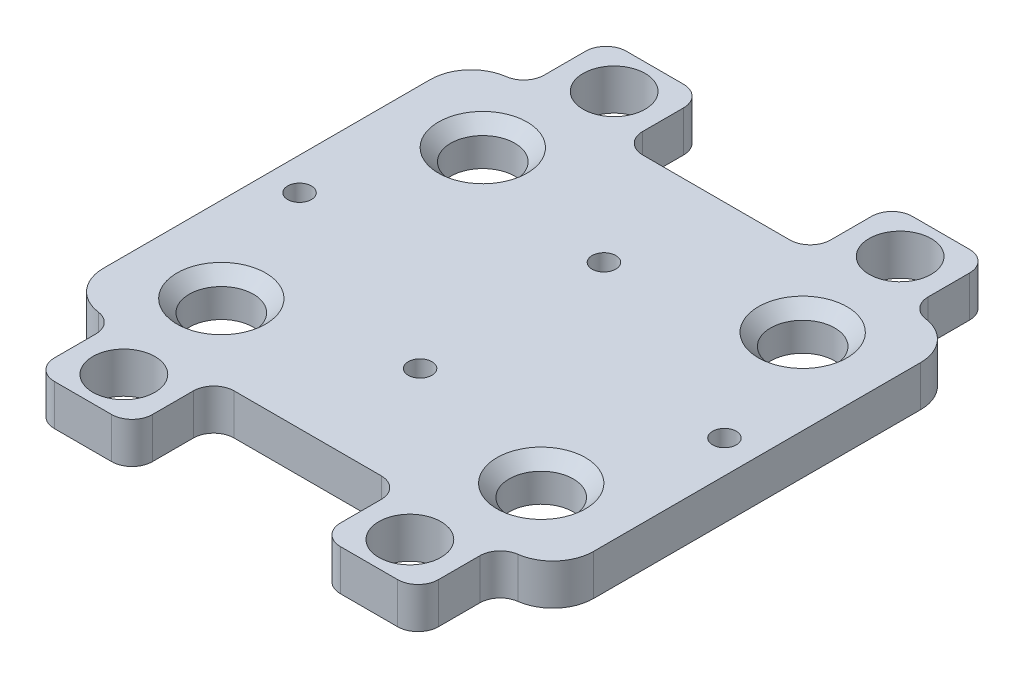
from build123d import *

# Parameters (mm, degrees)
SKETCH1_W           = 50
SKETCH1_H           = 5
BOSS_EXTRUDE1_DEPTH = 60
SKETCH2_R           = 3.925
SKETCH2_R_2         = 1.45
CUT_EXTRUDE1_DEPTH  = 79.262379212
CHAMFER1_SIZE       = 1.5
FILLET2_R           = 5
SKETCH2_3_W         = 12
SKETCH2_3_H         = 10
SKETCH2_3_R         = 3.8
BOSS_EXTRUDE2_DEPTH = 5
FILLET5_R           = 2.5
FILLET6_R           = 2.5
CHAMFER2_SIZE       = 1.5
CHAMFER3_SIZE       = 1.5


with BuildPart() as part:
    # Sketch1 → Boss-Extrude1 (new body)
    with BuildSketch(Plane(origin=(0, 0, 0), x_dir=(0, 0, -1), z_dir=(1, 0, 0))):
        with Locations((25, 2.5)):
            Rectangle(SKETCH1_W, SKETCH1_H)
    extrude(amount=BOSS_EXTRUDE1_DEPTH)

    # Sketch2 → Cut-Extrude1 (cut, through all)
    with BuildSketch(Plane(origin=(0, 5, 0), x_dir=(1, 0, 0), z_dir=(0, 1, 0))):
        with Locations((49.575, 41)):
            Circle(SKETCH2_R)
        with Locations((10.425, 41)):
            Circle(SKETCH2_R)
        with Locations((10.425, 9)):
            Circle(SKETCH2_R)
        with Locations((49.575, 9)):
            Circle(SKETCH2_R)
        with Locations((30, 36.25)):
            Circle(SKETCH2_R_2)
        with Locations((30, 13.75)):
            Circle(SKETCH2_R_2)
        with Locations((56, 25)):
            Circle(SKETCH2_R_2)
        with Locations((4, 25)):
            Circle(SKETCH2_R_2)
    extrude(amount=-CUT_EXTRUDE1_DEPTH, mode=Mode.SUBTRACT)

    # Chamfer1
    chamfer1_edges = [part.edges().sort_by_distance(p)[0] for p in [
        (6.5, 5, -9),
        (45.65, 5, -9),
        (6.5, 5, -41),
        (45.65, 5, -41),
    ]]
    chamfer(chamfer1_edges, length=CHAMFER1_SIZE)

    # Fillet2
    fillet2_edges = [part.edges().sort_by_distance(p)[0] for p in [
        (0, 2.5, -50),
        (0, 2.5, 0),
        (60, 2.5, 0),
        (60, 2.5, -50),
    ]]
    fillet(fillet2_edges, radius=FILLET2_R)

    # Sketch2<3> → Boss-Extrude2 (add)
    # profile 1 of 4: a face of its own
    with BuildSketch(Plane(origin=(0, 5, 0), x_dir=(1, 0, 0), z_dir=(0, 1, 0))):
        with Locations((47.5, 55)):
            Rectangle(SKETCH2_3_W, SKETCH2_3_H)
        with Locations((47.5, 55)):
            Circle(SKETCH2_3_R, mode=Mode.SUBTRACT)
    # profile 2 of 4: a face of its own
    with BuildSketch(Plane(origin=(0, 5, 0), x_dir=(1, 0, 0), z_dir=(0, 1, 0))):
        with Locations((12.5, 55)):
            Rectangle(SKETCH2_3_W, SKETCH2_3_H)
        with Locations((12.5, 55)):
            Circle(SKETCH2_3_R, mode=Mode.SUBTRACT)
    # profile 3 of 4: a face of its own
    with BuildSketch(Plane(origin=(0, 5, 0), x_dir=(1, 0, 0), z_dir=(0, 1, 0))):
        with Locations((47.5, -5)):
            Rectangle(SKETCH2_3_W, SKETCH2_3_H)
        with Locations((47.5, -5)):
            Circle(SKETCH2_3_R, mode=Mode.SUBTRACT)
    # profile 4 of 4: a face of its own
    with BuildSketch(Plane(origin=(0, 5, 0), x_dir=(1, 0, 0), z_dir=(0, 1, 0))):
        with Locations((12.5, -5)):
            Rectangle(SKETCH2_3_W, SKETCH2_3_H)
        with Locations((12.5, -5)):
            Circle(SKETCH2_3_R, mode=Mode.SUBTRACT)
    extrude(amount=-BOSS_EXTRUDE2_DEPTH)

    # Fillet5
    fillet5_edges = [part.edges().sort_by_distance(p)[0] for p in [
        (41.5, 2.5, 10),
        (53.5, 2.5, 10),
        (6.5, 2.5, 10),
        (18.5, 2.5, 10),
        (53.5, 2.5, -60),
        (41.5, 2.5, -60),
        (6.5, 2.5, -60),
        (18.5, 2.5, -60),
    ]]
    fillet(fillet5_edges, radius=FILLET5_R)

    # Fillet6
    fillet6_edges = [part.edges().sort_by_distance(p)[0] for p in [
        (18.5, 2.5, 0),
        (53.5, 2.5, 0),
        (6.5, 2.5, 0),
        (41.5, 2.5, 0),
        (6.5, 2.5, -50),
        (41.5, 2.5, -50),
        (53.5, 2.5, -50),
        (18.5, 2.5, -50),
    ]]
    fillet(fillet6_edges, radius=FILLET6_R)

    # Chamfer2
    chamfer2_edges = [part.edges().sort_by_distance(p)[0] for p in [
        (28.55, 0, -13.75),
        (54.55, 0, -25),
        (28.55, 0, -36.25),
    ]]
    chamfer(chamfer2_edges, length=CHAMFER2_SIZE)

    # Chamfer3
    chamfer3_edges = [part.edges().sort_by_distance(p)[0] for p in [
        (2.55, 0, -25),
    ]]
    chamfer(chamfer3_edges, length=CHAMFER3_SIZE)


solid = part.part
